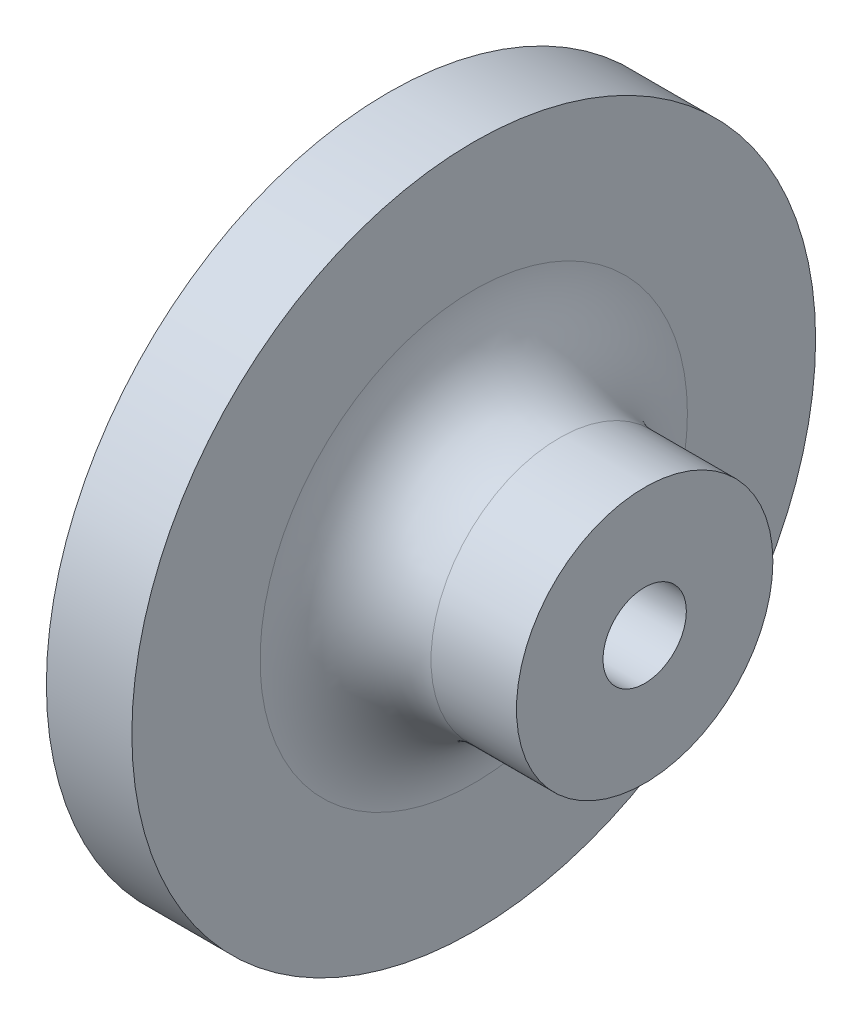
from build123d import *

# Parameters (mm, degrees)
ESQUISSE1_R             = 40
ESQUISSE1_R_2           = 5.5
BOSS_EXTRU_1_DEPTH      = 10
BOSS_EXTRU_2_START      = -7
ESQUISSE2_R             = 40
BOSS_EXTRU_2_DEPTH      = 7
ESQUISSE3_R             = 15
BOSS_EXTRU_3_DEPTH      = 20
CONG_1_R                = 10
ESQUISSE4_R             = 4.875
ENL_V_MAT_EXTRU_1_DEPTH = 16


with BuildPart() as part:
    # Esquisse1 → Boss.-Extru.1 (new body)
    with BuildSketch(Plane.YZ):
        Circle(ESQUISSE1_R)
        with Locations((0, 32)):
            Circle(ESQUISSE1_R_2, mode=Mode.SUBTRACT)
        with Locations((12.245869836, 29.56414504)):
            Circle(ESQUISSE1_R_2, mode=Mode.SUBTRACT)
        with Locations((22.627416998, 22.627416998)):
            Circle(ESQUISSE1_R_2, mode=Mode.SUBTRACT)
        with Locations((29.56414504, 12.245869836)):
            Circle(ESQUISSE1_R_2, mode=Mode.SUBTRACT)
        with Locations((32, 0)):
            Circle(ESQUISSE1_R_2, mode=Mode.SUBTRACT)
        with Locations((29.56414504, -12.245869836)):
            Circle(ESQUISSE1_R_2, mode=Mode.SUBTRACT)
        with Locations((22.627416998, -22.627416998)):
            Circle(ESQUISSE1_R_2, mode=Mode.SUBTRACT)
        with Locations((12.245869836, -29.56414504)):
            Circle(ESQUISSE1_R_2, mode=Mode.SUBTRACT)
        with Locations((0, -32)):
            Circle(ESQUISSE1_R_2, mode=Mode.SUBTRACT)
        with Locations((-12.245869836, -29.56414504)):
            Circle(ESQUISSE1_R_2, mode=Mode.SUBTRACT)
        with Locations((-22.627416998, -22.627416998)):
            Circle(ESQUISSE1_R_2, mode=Mode.SUBTRACT)
        with Locations((-29.56414504, -12.245869836)):
            Circle(ESQUISSE1_R_2, mode=Mode.SUBTRACT)
        with Locations((-32, 0)):
            Circle(ESQUISSE1_R_2, mode=Mode.SUBTRACT)
        with Locations((-29.56414504, 12.245869836)):
            Circle(ESQUISSE1_R_2, mode=Mode.SUBTRACT)
        with Locations((-22.627416998, 22.627416998)):
            Circle(ESQUISSE1_R_2, mode=Mode.SUBTRACT)
        with Locations((-12.245869836, 29.56414504)):
            Circle(ESQUISSE1_R_2, mode=Mode.SUBTRACT)
        with Locations((-11.429260712, 17.105097445)):
            Circle(ESQUISSE1_R_2, mode=Mode.SUBTRACT)
        with Locations((4.013422643, 20.17683815)):
            Circle(ESQUISSE1_R_2, mode=Mode.SUBTRACT)
        with Locations((17.105097445, 11.429260712)):
            Circle(ESQUISSE1_R_2, mode=Mode.SUBTRACT)
        with Locations((20.17683815, -4.013422643)):
            Circle(ESQUISSE1_R_2, mode=Mode.SUBTRACT)
        with Locations((11.429260712, -17.105097445)):
            Circle(ESQUISSE1_R_2, mode=Mode.SUBTRACT)
        with Locations((-4.013422643, -20.17683815)):
            Circle(ESQUISSE1_R_2, mode=Mode.SUBTRACT)
        with Locations((-17.105097445, -11.429260712)):
            Circle(ESQUISSE1_R_2, mode=Mode.SUBTRACT)
        with Locations((-20.17683815, 4.013422643)):
            Circle(ESQUISSE1_R_2, mode=Mode.SUBTRACT)
        with Locations((5.527683242, 8.272762594)):
            Circle(ESQUISSE1_R_2, mode=Mode.SUBTRACT)
        with Locations((8.272762594, -5.527683242)):
            Circle(ESQUISSE1_R_2, mode=Mode.SUBTRACT)
        with Locations((-5.527683242, -8.272762594)):
            Circle(ESQUISSE1_R_2, mode=Mode.SUBTRACT)
        with Locations((-8.272762594, 5.527683242)):
            Circle(ESQUISSE1_R_2, mode=Mode.SUBTRACT)
    extrude(amount=BOSS_EXTRU_1_DEPTH)

    # Esquisse2 → Boss.-Extru.2 (add)
    with BuildSketch(Plane.YZ.offset(10).offset(BOSS_EXTRU_2_START)):
        Circle(ESQUISSE2_R)
    extrude(amount=BOSS_EXTRU_2_DEPTH)

    # Esquisse3 → Boss.-Extru.3 (add)
    with BuildSketch(Plane.YZ.offset(10)):
        Circle(ESQUISSE3_R)
    extrude(amount=BOSS_EXTRU_3_DEPTH)

    # Congé1
    cong_1_edges = [part.edges().sort_by_distance(p)[0] for p in [
        (10, -15, 0),
    ]]
    fillet(cong_1_edges, radius=CONG_1_R)

    # Esquisse4 → Enlèv. mat.-Extru.1 (cut)
    with BuildSketch(Plane.YZ.offset(30)):
        Circle(ESQUISSE4_R)
    extrude(amount=-ENL_V_MAT_EXTRU_1_DEPTH, mode=Mode.SUBTRACT)


solid = part.part
